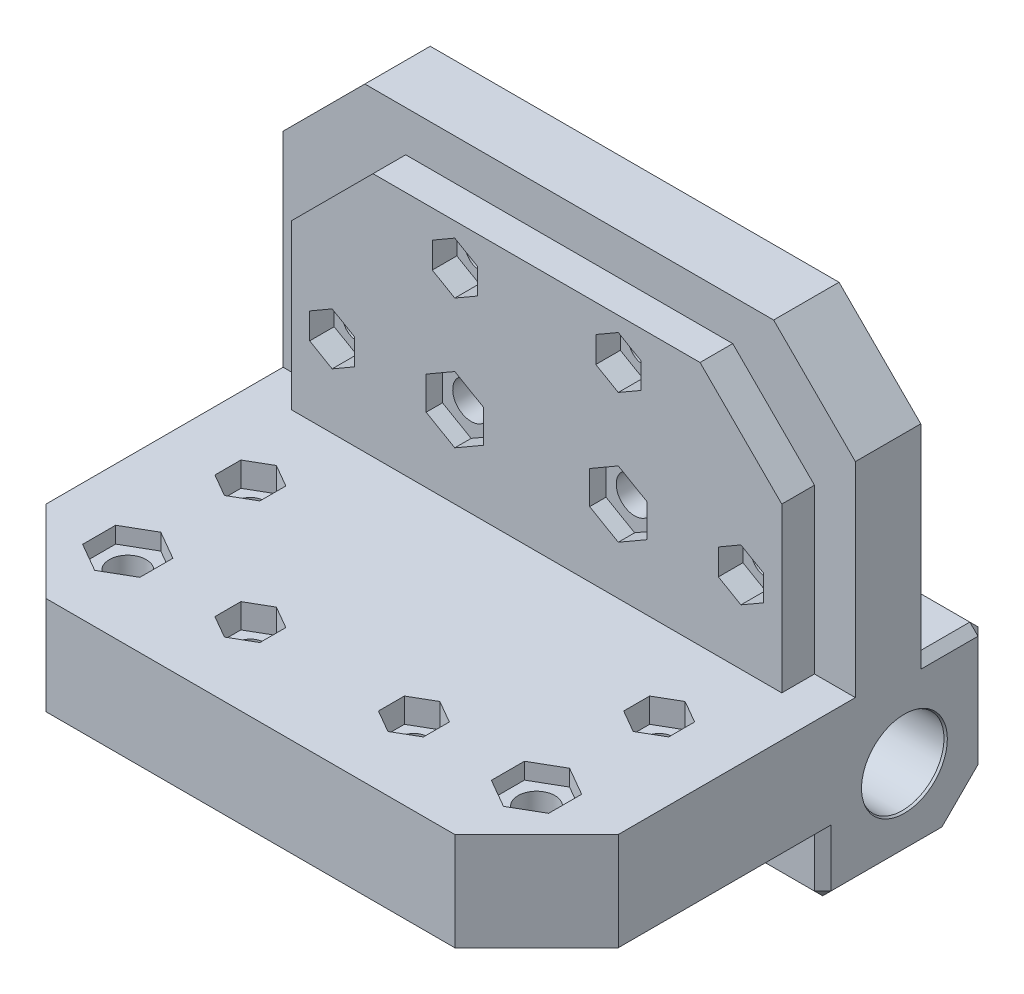
from build123d import *

# Parameters (mm, degrees)
BODY_DEPTH                             = 70
FRONTAL_M3_NUT_CUTOUTS_DEPTH           = 3
FRONTAL_M4_NUT_CUTOUT_DEPTH            = 2
MAIN_CHAMFER_SIZE                      = 5
SIDE_CHAMFER_SIZE                      = 1
WALL_CHAMFERS_SIZE                     = 10
CLEARANCE_CUTOUT_DEPTH                 = 4
M3_FULL_MIRROR_COPY_3_DEPTH            = 3
BOTTOM_BOARD_MOUNTING_HOLE_D           = 4.5
BOTTOM_BOARD_MOUNTING_HOLE_CBORE_D     = 8
BOTTOM_BOARD_MOUNTING_HOLE_CBORE_DEPTH = 4.4
BOTTOM_M4_NUT_CUTOUT_DEPTH             = 2


# Read off the part's stored shape, not the designer's step: hull_mounting_holes
with BuildPart() as part:
    # body_sketch → body (new body)
    with BuildSketch(Plane(origin=(0, 0, 0), x_dir=(0, 0, -1), z_dir=(1, 0, 0))):
        Polygon((0, 0), (0, 20), (-8, 20), (-8, 55), (-20, 55), (-20, 20), (-55, 20), (-55, 8), (-20, 8), (-20, 0), align=None)
    extrude(amount=BODY_DEPTH)

    # rod_hole_sketch_auto → rod_hole_d10 (revolve, cut)
    with BuildSketch(Plane(origin=(70, 10, 10), x_dir=(0, 0, -1), z_dir=(0, 1, 0))):
        Polygon((0, 0), (0, 70), (5.25, 70), (5.1, 69.740192379), (5.1, 0.259807621), (5.25, 0), align=None)
    revolve(axis=Axis((76.35, 10, 10), (-1, 0, 0)), mode=Mode.SUBTRACT)

    # hull_mounting_holes outline → hull_mounting_holes (revolve, cut)
    with BuildSketch(Plane(origin=(25, 45, 0), x_dir=(1, 0, 0), z_dir=(0, -1, 0))):
        Polygon((0, 8), (1.8, 8), (1.7, 8.1), (1.7, 19.9), (1.8, 20), (0, 20), align=None)
    hull_mounting_holes = revolve(axis=Axis((25, 45, 0), (0, 0, 1)), mode=Mode.SUBTRACT)

    # hull_mounting_holes 2 outline → hull_mounting_holes 2 (revolve, cut)
    with BuildSketch(Plane(origin=(10, 30, 0), x_dir=(1, 0, 0), z_dir=(0, -1, 0))):
        Polygon((0, 8), (1.8, 8), (1.7, 8.1), (1.7, 19.9), (1.8, 20), (0, 20), align=None)
    hull_mounting_holes_2 = revolve(axis=Axis((10, 30, 0), (0, 0, 1)), mode=Mode.SUBTRACT)

    # Sketch8 → board_mounting_hole (revolve, cut)
    with BuildSketch(Plane(origin=(25, 30, 8), x_dir=(0, 1, 0), z_dir=(1, 0, 0))):
        Polygon((0, 0), (0, 12), (2.275, 12), (2.25, 11.975), (2.25, 4.4), (4, 4.4), (4, 0.025), (4.025, 0), align=None)
    board_mounting_hole = revolve(axis=Axis((25, 30, 1.65), (0, 0, 1)), mode=Mode.SUBTRACT)

    # Sketch9 → frontal_m3_nut_cutouts (cut)
    with BuildSketch(Plane.XY.offset(20)):
        Polygon((25, 48.175426481), (22.25, 46.58771324), (22.25, 43.41228676), (25, 41.824573519), (27.75, 43.41228676), (27.75, 46.58771324), align=None)
        Polygon((10, 33.175426481), (7.25, 31.58771324), (7.25, 28.41228676), (10, 26.824573519), (12.75, 28.41228676), (12.75, 31.58771324), align=None)
    frontal_m3_nut_cutouts = extrude(amount=-FRONTAL_M3_NUT_CUTOUTS_DEPTH, mode=Mode.SUBTRACT)

    # Sketch10 → frontal_m4_nut_cutout (cut)
    with BuildSketch(Plane.XY.offset(20)):
        Polygon((21.5, 32.020725942), (21.5, 27.979274058), (25, 25.958548116), (28.5, 27.979274058), (28.5, 32.020725942), (25, 34.041451884), align=None)
    frontal_m4_nut_cutout = extrude(amount=-FRONTAL_M4_NUT_CUTOUT_DEPTH, mode=Mode.SUBTRACT)

    # frontal_m4_mirror: board_mounting_hole, frontal_m4_nut_cutout across plane
    add(board_mounting_hole.mirror(Plane.ZY.offset(-35)), mode=Mode.SUBTRACT)
    add(frontal_m4_nut_cutout.mirror(Plane.ZY.offset(-35)), mode=Mode.SUBTRACT)

    # main_chamfer
    main_chamfer_edges = [part.edges().sort_by_distance(p)[0] for p in [
        (35, 0, 0),
    ]]
    chamfer(main_chamfer_edges, length=MAIN_CHAMFER_SIZE)

    # side_chamfer
    side_chamfer_edges = [part.edges().sort_by_distance(p)[0] for p in [
        (0, 4, 20),
        (70, 20, 4),
        (0, 20, 4),
        (0, 0, 12.5),
        (0, 12.5, 0),
        (70, 12.5, 0),
        (0, 2.5, 2.5),
        (70, 2.5, 2.5),
        (35, 0, 20),
        (35, 20, 0),
        (70, 4, 20),
        (70, 0, 12.5),
    ]]
    chamfer(side_chamfer_edges, length=SIDE_CHAMFER_SIZE)

    # wall_chamfers
    wall_chamfers_edges = [part.edges().sort_by_distance(p)[0] for p in [
        (0, 14, 55),
        (0, 55, 14),
        (70, 55, 14),
        (70, 14, 55),
    ]]
    chamfer(wall_chamfers_edges, length=WALL_CHAMFERS_SIZE)

    # Sketch11 → clearance_cutout (cut)
    with BuildSketch(Plane.XY.offset(20)):
        Polygon((0, 20), (5, 20), (5, 40), (15, 50), (55, 50), (65, 40), (65, 20), (70, 20), (70, 45), (60, 55), (10, 55), (0, 45), align=None)
    extrude(amount=-CLEARANCE_CUTOUT_DEPTH, mode=Mode.SUBTRACT)

    # bottom_m3_mirror: hull_mounting_holes, hull_mounting_holes 2, frontal_m3_nut_cutouts across plane
    add(hull_mounting_holes.mirror(Plane(origin=(0, 0, 0), x_dir=(0, 0.7071067811865476, 0.7071067811865475), z_dir=(0, 0.7071067811865475, -0.7071067811865476))), mode=Mode.SUBTRACT)
    add(hull_mounting_holes_2.mirror(Plane(origin=(0, 0, 0), x_dir=(0, 0.7071067811865476, 0.7071067811865475), z_dir=(0, 0.7071067811865475, -0.7071067811865476))), mode=Mode.SUBTRACT)
    add(frontal_m3_nut_cutouts.mirror(Plane(origin=(0, 0, 0), x_dir=(0, 0.7071067811865476, 0.7071067811865475), z_dir=(0, 0.7071067811865475, -0.7071067811865476))), mode=Mode.SUBTRACT)

    # m3_full_mirror: hull_mounting_holes, hull_mounting_holes 2, frontal_m3_nut_cutouts across plane
    add(hull_mounting_holes.mirror(Plane.ZY.offset(-35)), mode=Mode.SUBTRACT)
    add(hull_mounting_holes_2.mirror(Plane.ZY.offset(-35)), mode=Mode.SUBTRACT)
    add(frontal_m3_nut_cutouts.mirror(Plane.ZY.offset(-35)), mode=Mode.SUBTRACT)

    # m3_full_mirror copy 1 sketch → m3_full_mirror copy 1 (revolve, cut)
    with BuildSketch(Plane(origin=(45, 0, 45), x_dir=(-1, 0, 0), z_dir=(0, 0, -1))):
        Polygon((0, 8), (1.8, 8), (1.7, 8.1), (1.7, 19.9), (1.8, 20), (0, 20), align=None)
    revolve(axis=Axis((45, 0, 45), (0, 1, 0)), mode=Mode.SUBTRACT)

    # m3_full_mirror copy 2 sketch → m3_full_mirror copy 2 (revolve, cut)
    with BuildSketch(Plane(origin=(60, 0, 30), x_dir=(-1, 0, 0), z_dir=(0, 0, -1))):
        Polygon((0, 8), (1.8, 8), (1.7, 8.1), (1.7, 19.9), (1.8, 20), (0, 20), align=None)
    revolve(axis=Axis((60, 0, 30), (0, 1, 0)), mode=Mode.SUBTRACT)

    # m3_full_mirror copy 3 sketch → m3_full_mirror copy 3 (cut)
    with BuildSketch(Plane(origin=(70, 20, 0), x_dir=(-1, 0, 0), z_dir=(0, 1, 0))):
        Polygon((25, 48.175426481), (22.25, 46.58771324), (22.25, 43.41228676), (25, 41.824573519), (27.75, 43.41228676), (27.75, 46.58771324), align=None)
        Polygon((10, 33.175426481), (7.25, 31.58771324), (7.25, 28.41228676), (10, 26.824573519), (12.75, 28.41228676), (12.75, 31.58771324), align=None)
    extrude(amount=-M3_FULL_MIRROR_COPY_3_DEPTH, mode=Mode.SUBTRACT)

    # m3_full_mirror copy 4 sketch → m3_full_mirror copy 4 (revolve, cut)
    with BuildSketch(Plane(origin=(60, 30, 0), x_dir=(-1, 0, 0), z_dir=(0, -1, 0))):
        Polygon((0, -8), (1.8, -8), (1.7, -8.1), (1.7, -19.9), (1.8, -20), (0, -20), align=None)
    revolve(axis=Axis((60, 30, 0), (0, 0, -1)), mode=Mode.SUBTRACT)

    # bottom_board_mounting_hole (through all)
    with Locations(Plane.XZ.offset(-8)):
        with Locations((10, 45)):
            bottom_board_mounting_hole = CounterBoreHole(BOTTOM_BOARD_MOUNTING_HOLE_D / 2, BOTTOM_BOARD_MOUNTING_HOLE_CBORE_D / 2, BOTTOM_BOARD_MOUNTING_HOLE_CBORE_DEPTH)

    # Sketch15 → bottom_m4_nut_cutout (cut)
    with BuildSketch(Plane(origin=(0, 20, 0), x_dir=(1, 0, 0), z_dir=(0, 1, 0))):
        Polygon((10, -40.958548116), (6.5, -42.979274058), (6.5, -47.020725942), (10, -49.041451884), (13.5, -47.020725942), (13.5, -42.979274058), align=None)
    bottom_m4_nut_cutout = extrude(amount=-BOTTOM_M4_NUT_CUTOUT_DEPTH, mode=Mode.SUBTRACT)

    # bottom_m4_mirror: bottom_board_mounting_hole, bottom_m4_nut_cutout across plane
    add(bottom_board_mounting_hole.mirror(Plane.ZY.offset(-35)), mode=Mode.SUBTRACT)
    add(bottom_m4_nut_cutout.mirror(Plane.ZY.offset(-35)), mode=Mode.SUBTRACT)


solid = part.part
